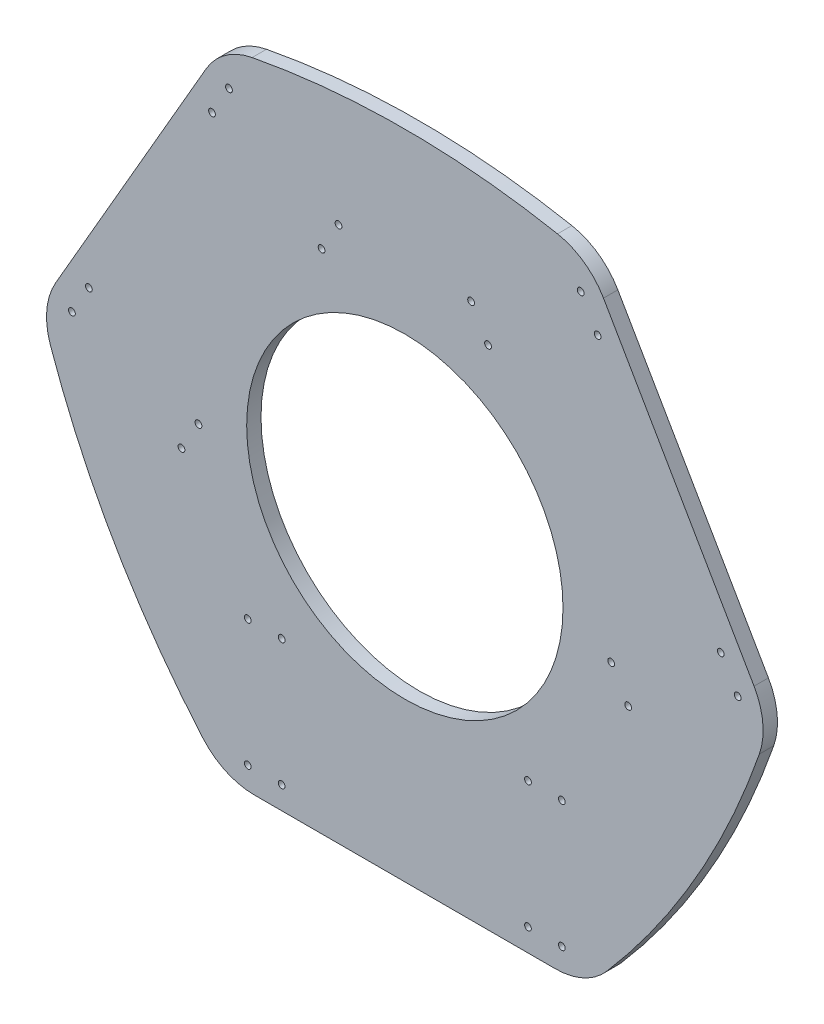
from build123d import *

# Parameters (mm, degrees)
SKETCH1_R           = 1.5
SKETCH1_R_2         = 70
BOSS_EXTRUDE2_DEPTH = 6.35
FILLET1_R           = 30
CIRPATTERN1_DEPTH   = 6.35


# Read off the part's stored shape, not the designer's step: CirPattern1
with BuildPart() as part:
    # Sketch1 → Boss-Extrude2 (new body)
    with BuildSketch(Plane.XY):
        with BuildLine():
            ThreePointArc((80, -140), (128.664709099, -74.284604433), (161.24355653, 0.717967697))
            Line((161.24355653, 0.717967697), (81.24355653, 139.282032303))
            ThreePointArc((81.24355653, 139.282032303), (0, 148.569208867), (-81.24355653, 139.282032303))
            Line((-81.24355653, 139.282032303), (-161.24355653, 0.717967697))
            ThreePointArc((-161.24355653, 0.717967697), (-128.664709099, -74.284604433), (-80, -140))
            Line((-80, -140), (80, -140))
        make_face()
        with Locations((85.333302492, 112.198384506)):
            Circle(SKETCH1_R, mode=Mode.SUBTRACT)
        with Locations((-85.333302492, 112.198384506)):
            Circle(SKETCH1_R, mode=Mode.SUBTRACT)
        with Locations((-69.5, -130)):
            Circle(SKETCH1_R, mode=Mode.SUBTRACT)
        with Locations((-54.5, -130)):
            Circle(SKETCH1_R, mode=Mode.SUBTRACT)
        with Locations((-69.5, -74)):
            Circle(SKETCH1_R, mode=Mode.SUBTRACT)
        with Locations((-54.5, -74)):
            Circle(SKETCH1_R, mode=Mode.SUBTRACT)
        with Locations((-98.83587988, -23.188765563)):
            Circle(SKETCH1_R, mode=Mode.SUBTRACT)
        with Locations((54.5, -130)):
            Circle(SKETCH1_R, mode=Mode.SUBTRACT)
        with Locations((69.5, -130)):
            Circle(SKETCH1_R, mode=Mode.SUBTRACT)
        with Locations((54.5, -74)):
            Circle(SKETCH1_R, mode=Mode.SUBTRACT)
        with Locations((69.5, -74)):
            Circle(SKETCH1_R, mode=Mode.SUBTRACT)
        with Locations((98.83587988, -23.188765563)):
            Circle(SKETCH1_R, mode=Mode.SUBTRACT)
        with Locations((-147.333302492, 4.811234437)):
            Circle(SKETCH1_R, mode=Mode.SUBTRACT)
        with Locations((-91.33587988, -10.198384506)):
            Circle(SKETCH1_R, mode=Mode.SUBTRACT)
        with Locations((-139.833302492, 17.801615494)):
            Circle(SKETCH1_R, mode=Mode.SUBTRACT)
        Circle(SKETCH1_R_2, mode=Mode.SUBTRACT)
        with Locations((-36.83587988, 84.198384506)):
            Circle(SKETCH1_R, mode=Mode.SUBTRACT)
        with Locations((-29.33587988, 97.188765563)):
            Circle(SKETCH1_R, mode=Mode.SUBTRACT)
        with Locations((91.33587988, -10.198384506)):
            Circle(SKETCH1_R, mode=Mode.SUBTRACT)
        with Locations((147.333302492, 4.811234437)):
            Circle(SKETCH1_R, mode=Mode.SUBTRACT)
        with Locations((139.833302492, 17.801615494)):
            Circle(SKETCH1_R, mode=Mode.SUBTRACT)
        with Locations((36.83587988, 84.198384506)):
            Circle(SKETCH1_R, mode=Mode.SUBTRACT)
        with Locations((29.33587988, 97.188765563)):
            Circle(SKETCH1_R, mode=Mode.SUBTRACT)
        with Locations((77.833302492, 125.188765563)):
            Circle(SKETCH1_R, mode=Mode.SUBTRACT)
        with Locations((-77.833302492, 125.188765563)):
            Circle(SKETCH1_R, mode=Mode.SUBTRACT)
    extrude(amount=BOSS_EXTRUDE2_DEPTH)

    # Fillet1
    fillet1_edges = [part.edges().sort_by_distance(p)[0] for p in [
        (-161.24355653, 0.717967697, 3.175),
        (-81.24355653, 139.282032303, 3.175),
    ]]
    fillet(fillet1_edges, radius=FILLET1_R)

    # CirPattern1 outline → CirPattern1 (cut)
    with BuildSketch(Plane.XY):
        with BuildLine():
            ThreePointArc((81.24355653, 139.282032303), (74.425715453, 140.791884002), (67.57987135, 142.169210265))
            ThreePointArc((67.57987135, 142.169210265), (79.330889418, 137.153364411), (87.928977518, 127.702543481))
            Line((87.928977518, 127.702543481), (81.24355653, 139.282032303))
        make_face()
        with BuildLine():
            Line((-80, -140), (-66.629158024, -140))
            ThreePointArc((-66.629158024, -140), (-79.112853086, -137.279247746), (-89.33221205, -129.610490506))
            ThreePointArc((-89.33221205, -129.610490506), (-84.716490466, -134.850502278), (-80, -140))
        make_face()
        with BuildLine():
            ThreePointArc((80, -140), (84.716490466, -134.850502278), (89.33221205, -129.610490506))
            ThreePointArc((89.33221205, -129.610490506), (79.112853086, -137.279247746), (66.629158024, -140))
            Line((66.629158024, -140), (80, -140))
        make_face()
        with BuildLine():
            Line((161.24355653, 0.717967697), (154.558135542, 12.297456519))
            ThreePointArc((154.558135542, 12.297456519), (158.443742503, 0.125883335), (156.9120834, -12.558719758))
            ThreePointArc((156.9120834, -12.558719758), (159.142205919, -5.941381724), (161.24355653, 0.717967697))
        make_face()
    extrude(amount=CIRPATTERN1_DEPTH, mode=Mode.SUBTRACT)


solid = part.part
